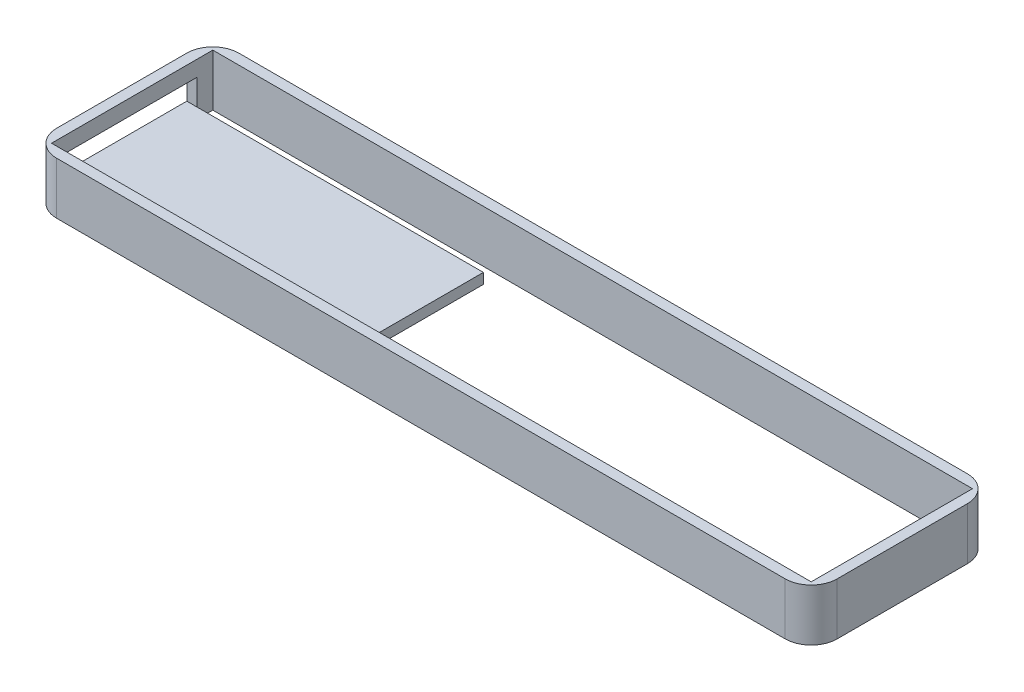
from build123d import *

# Parameters (mm, degrees)
SKETCH1_W           = 150
SKETCH1_H           = 35
SKETCH1_W_2         = 146
SKETCH1_H_2         = 31
SKETCH1_W_3         = 55
SKETCH1_H_3         = 25
BOSS_EXTRUDE1_DEPTH = 10
SKETCH2_W           = 55
SKETCH2_H           = 25
CUT_EXTRUDE3_DEPTH  = 8
SKETCH6_W           = 25
SKETCH6_H           = 5
CUT_EXTRUDE4_DEPTH  = 8
FILLET1_R           = 5


with BuildPart() as part:
    # Sketch1 → Boss-Extrude1 (new body)
    # profile 1 of 2: a face of its own
    with BuildSketch(Plane(origin=(0, 0, 0), x_dir=(1, 0, 0), z_dir=(0, 1, 0))):
        Rectangle(SKETCH1_W, SKETCH1_H)
        Rectangle(SKETCH1_W_2, SKETCH1_H_2, mode=Mode.SUBTRACT)
    # profile 2 of 2: a face of its own
    with BuildSketch(Plane(origin=(0, 0, 0), x_dir=(1, 0, 0), z_dir=(0, 1, 0))):
        with Locations((-45.5, 0)):
            Rectangle(SKETCH1_W_3, SKETCH1_H_3)
    extrude(amount=BOSS_EXTRUDE1_DEPTH)

    # Sketch2 → Cut-Extrude3 (cut)
    with BuildSketch(Plane(origin=(0, 10, 0), x_dir=(1, 0, 0), z_dir=(0, 1, 0))):
        with Locations((-45.5, 0)):
            Rectangle(SKETCH2_W, SKETCH2_H)
    extrude(amount=-CUT_EXTRUDE3_DEPTH, mode=Mode.SUBTRACT)

    # Sketch6 → Cut-Extrude4 (cut)
    with BuildSketch(Plane.ZY.offset(75)):
        with Locations((0, 4.5)):
            Rectangle(SKETCH6_W, SKETCH6_H)
    extrude(amount=-CUT_EXTRUDE4_DEPTH, mode=Mode.SUBTRACT)

    # Fillet1
    fillet1_edges = [part.edges().sort_by_distance(p)[0] for p in [
        (-75, 5, 17.5),
        (-75, 5, -17.5),
        (75, 5, -17.5),
        (75, 5, 17.5),
    ]]
    fillet(fillet1_edges, radius=FILLET1_R - 0.0001)  # a hair under: the kernel refuses the full size


solid = part.part
